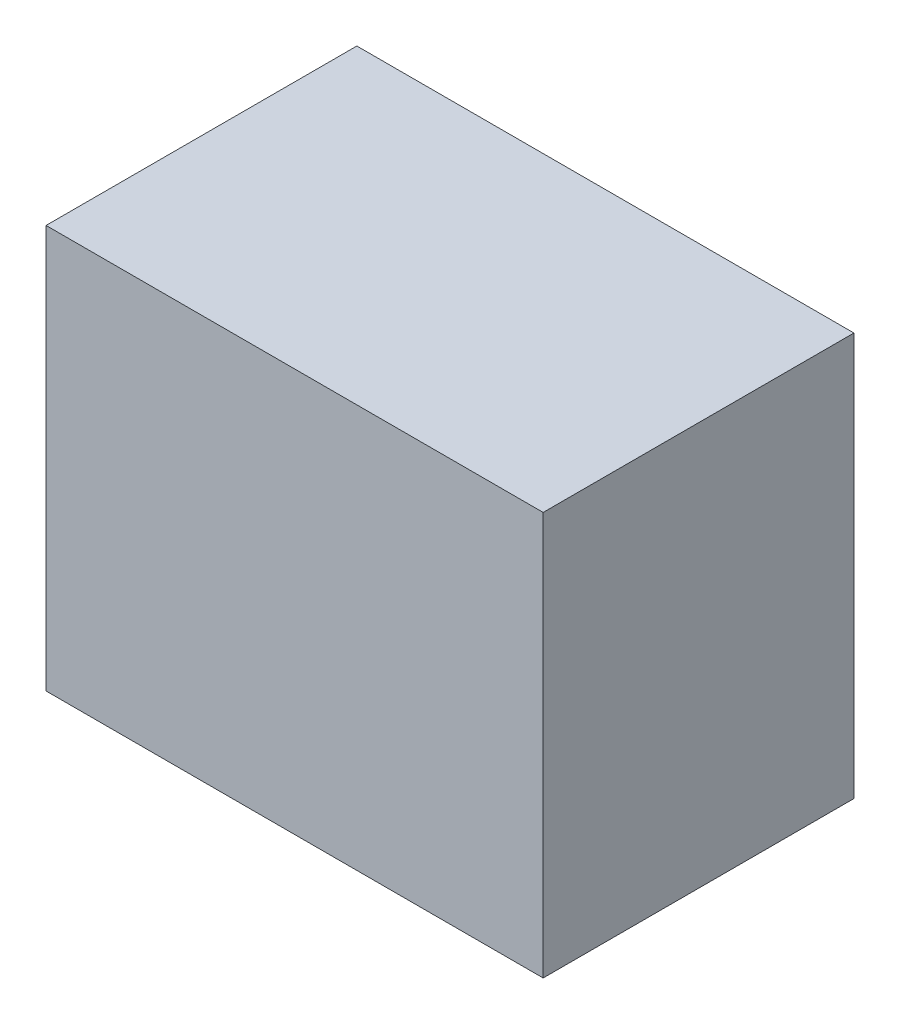
from build123d import *

# Parameters (mm, degrees)
SKETCH2_W           = 134.477697302
SKETCH2_H           = 109.076354478
BOSS_EXTRUDE1_DEPTH = 84.074


with BuildPart() as part:
    # Sketch2 → Boss-Extrude1 (new body)
    with BuildSketch(Plane.XY):
        Rectangle(SKETCH2_W, SKETCH2_H)
    extrude(amount=BOSS_EXTRUDE1_DEPTH)


solid = part.part
